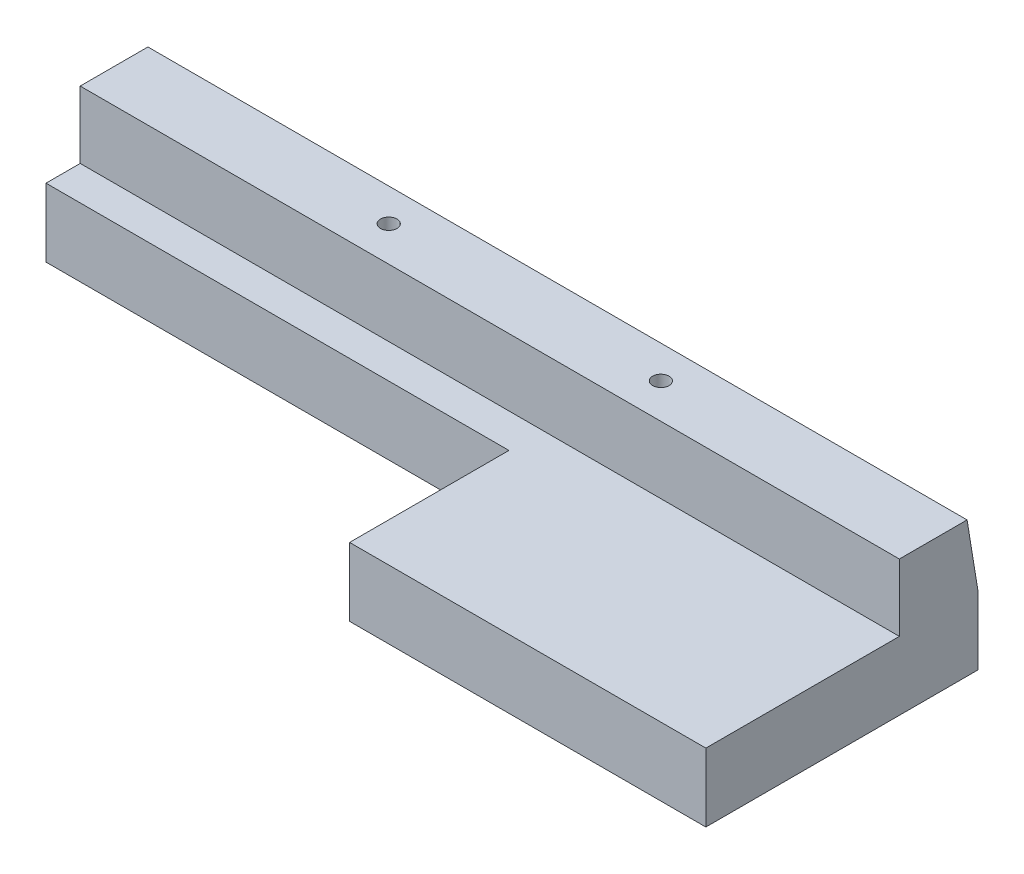
from build123d import *

# Parameters (mm, degrees)
SZKIC1_W                                             = 119.8
SZKIC1_H                                             = 10
DODANIE_WYCI_GNI_CIE2_DEPTH                          = 38.3
SZKIC21_W                                            = 119.8
SZKIC21_H                                            = 10
DODANIE_WYCI_GNI_CIE3_DEPTH                          = 9.8
POG_BIENIE_WALCOWE_POD_M2_WKR_T_DO_CZ_CI_D           = 2.4
POG_BIENIE_WALCOWE_POD_M2_WKR_T_DO_CZ_CI_CBORE_D     = 5
POG_BIENIE_WALCOWE_POD_M2_WKR_T_DO_CZ_CI_CBORE_DEPTH = 1.6
SZKIC28_R                                            = 11.1
WYTNIJ_WYCI_GNI_CIE1_DEPTH                           = 7.2
WYTNIJ_WYCI_GNI_CIE4_DEPTH                           = 124.8
DODANIE_WYCI_GNI_CIE5_DEPTH                          = 119.8
SZKIC34_W                                            = 119.8
SZKIC34_H                                            = 10
DODANIE_WYCI_GNI_CIE6_DEPTH                          = 1.5
SZKIC38_W                                            = 67.7
SZKIC38_H                                            = 10
WYTNIJ_WYCI_GNI_CIE5_DEPTH                           = 23.3
SZKIC39_R                                            = 5.1
WYTNIJ_WYCI_GNI_CIE6_DEPTH                           = 4.1


with BuildPart() as part:
    # Szkic1 → Dodanie-wyciągnięcie2 (new body)
    with BuildSketch(Plane.XY):
        with Locations((1.59336777, 27.024849398)):
            Rectangle(SZKIC1_W, SZKIC1_H)
    extrude(amount=DODANIE_WYCI_GNI_CIE2_DEPTH)

    # Szkic21 → Dodanie-wyciągnięcie3 (add)
    with BuildSketch(Plane(origin=(0, 32.024849398, 0), x_dir=(1, 0, 0), z_dir=(0, 1, 0))):
        with Locations((1.59336777, -5)):
            Rectangle(SZKIC21_W, SZKIC21_H)
    extrude(amount=DODANIE_WYCI_GNI_CIE3_DEPTH)

    # Pogłębienie walcowe pod M2 wkręt do części metalowych z łbem stożkowym ściętym2 (through all)
    with Locations(Plane(origin=(0, 22.024849398, 0), x_dir=(-1, 0, 0), z_dir=(0, -1, 0))):
        with Locations((-21.49336777, -4.88), (18.30663223, -4.88)):
            CounterBoreHole(POG_BIENIE_WALCOWE_POD_M2_WKR_T_DO_CZ_CI_D / 2, POG_BIENIE_WALCOWE_POD_M2_WKR_T_DO_CZ_CI_CBORE_D / 2, POG_BIENIE_WALCOWE_POD_M2_WKR_T_DO_CZ_CI_CBORE_DEPTH)

    # Szkic28 → Wytnij-wyciągnięcie1 (cut)
    with BuildSketch(Plane.XZ.offset(-22.024849398)):
        with Locations((36.49336777, 23.3)):
            Circle(SZKIC28_R)
    extrude(amount=-WYTNIJ_WYCI_GNI_CIE1_DEPTH, mode=Mode.SUBTRACT)

    # Szkic31 → Wytnij-wyciągnięcie4 (cut)
    with BuildSketch(Plane(origin=(61.49336777, 0, 0), x_dir=(0, 0, -1), z_dir=(1, 0, 0))):
        Polygon((0, 41.824849398), (-0.096491228, 41.824849398), (0, 41.232541705), align=None)
    extrude(amount=-WYTNIJ_WYCI_GNI_CIE4_DEPTH, mode=Mode.SUBTRACT)

    # Szkic31<5> → Dodanie-wyciągnięcie5 (add)
    with BuildSketch(Plane(origin=(61.49336777, 0, 0), x_dir=(0, 0, -1), z_dir=(1, 0, 0))):
        Polygon((0, 41.232541705), (0, 32.024849398), (1.5, 32.024849398), (0.275236278, 39.543014399), align=None)
    extrude(amount=-DODANIE_WYCI_GNI_CIE5_DEPTH)

    # Szkic34 → Dodanie-wyciągnięcie6 (add)
    with BuildSketch(Plane(origin=(0, 0, 0), x_dir=(-1, 0, 0), z_dir=(0, 0, -1))):
        with Locations((-1.59336777, 27.024849398)):
            Rectangle(SZKIC34_W, SZKIC34_H)
    extrude(amount=DODANIE_WYCI_GNI_CIE6_DEPTH)


with BuildPart() as body_2:
    # Lustro2: mirrored copy
    add(part.part.mirror(Plane(origin=(-58.30663223, 22.024849398, 38.3), x_dir=(0, 0, 1), z_dir=(0, 1, 0))))


with BuildPart() as body_2_1:
    # Obiekt-Przenieś/Kopiuj1: moved
    add(body_2.part.moved(Location((0, -36.76628261, 0))))

    # Szkic38 → Wytnij-wyciągnięcie5 (cut)
    with BuildSketch(Plane.XY.offset(38.3)):
        with Locations((-24.45663223, -19.741433212)):
            Rectangle(SZKIC38_W, SZKIC38_H)
    extrude(amount=-WYTNIJ_WYCI_GNI_CIE5_DEPTH, mode=Mode.SUBTRACT)


with BuildPart() as body_2_2:
    # Lustro3: mirrored copy
    add(body_2_1.part.mirror(Plane(origin=(11.571570583, -14.741433212, 13.198156942), x_dir=(0, 0, 1), z_dir=(0, 1, 0))))


with BuildPart() as body_2_2_1:
    # Obiekt-Przenieś/Kopiuj2: moved
    add(body_2_2.part.moved(Location((0, 52.156291161, 0))))

    # Szkic39 → Wytnij-wyciągnięcie6 (cut)
    with BuildSketch(Plane.XZ.offset(-37.414857948)):
        with Locations((-45.80663223, 8.5)):
            Circle(SZKIC39_R)
        with Locations((-8.30663223, 8.5)):
            Circle(SZKIC39_R)
    extrude(amount=-WYTNIJ_WYCI_GNI_CIE6_DEPTH, mode=Mode.SUBTRACT)


solid = body_2_2_1.part
